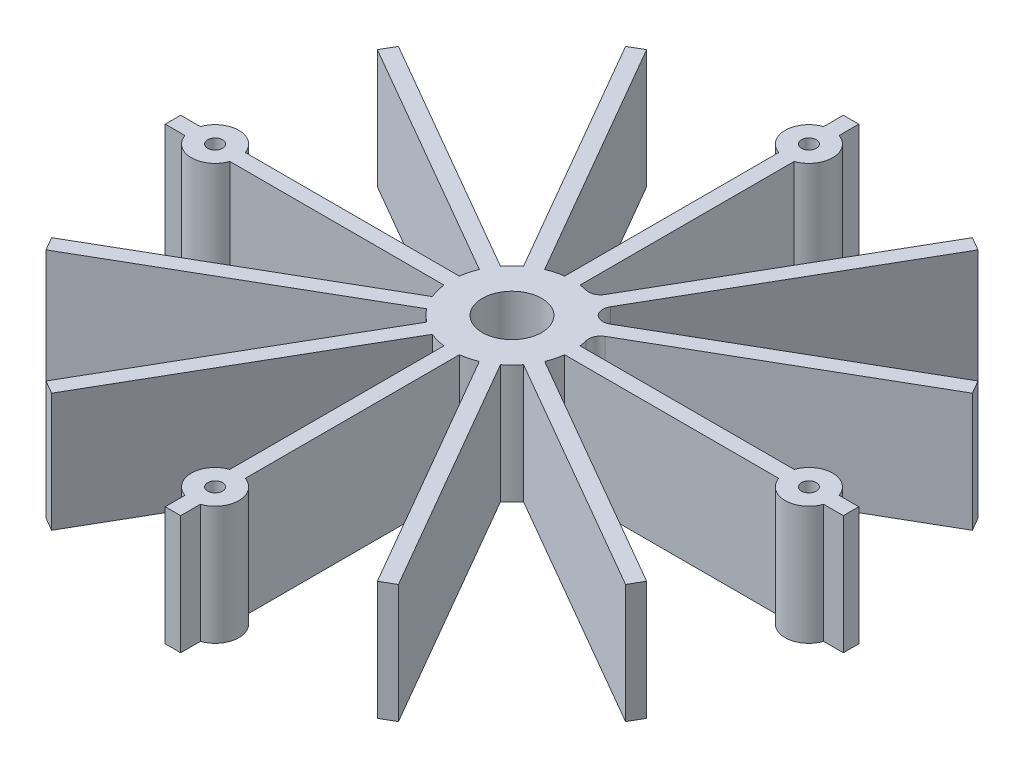
from build123d import *

# Parameters (mm, degrees)
SKETCH1_W           = 6.6675
SKETCH1_H           = 25.4
SKETCH2_W           = 3.302
SKETCH2_H           = 62.357
BOSS_EXTRUDE1_DEPTH = 25.4
CIRPATTERN1_COUNT   = 12
FILLET1_R           = 2.54
SKETCH4_R           = 5.08
SKETCH4_R_2         = 1.5875
BOSS_EXTRUDE2_DEPTH = 25.4
SKETCH5_R           = 1.5875
CUT_EXTRUDE2_DEPTH  = 25.4
CIRPATTERN2_COUNT   = 4


with BuildPart() as part:
    # Sketch1 → Revolve1 (revolve)
    with BuildSketch(Plane.XY, mode=Mode.PRIVATE) as revolve1_sk:
        with Locations((9.68375, 0)):
            Rectangle(SKETCH1_W, SKETCH1_H)
    revolve(revolve1_sk.sketch.rotate(Axis((0, 37.278132, 0), (0, -1, 0)), 90), axis=Axis((0, 37.278132, 0), (0, -1, 0)))

    # Sketch2 → Boss-Extrude1 (add)
    with BuildSketch(Plane(origin=(0, 12.7, 0), x_dir=(1, 0, 0), z_dir=(0, 1, 0))):
        with Locations((0, -41.3385)):
            Rectangle(SKETCH2_W, SKETCH2_H)
    boss_extrude1 = extrude(amount=-BOSS_EXTRUDE1_DEPTH)

    # CirPattern1: Boss-Extrude1 ×12 about axis
    cirpattern1_axis = Axis((0, 0, 0), (0, 1, 0))
    for i in range(1, CIRPATTERN1_COUNT):
        add(boss_extrude1.rotate(cirpattern1_axis, i * 360 / CIRPATTERN1_COUNT))

    # Fillet1
    # the kernel refuses this fillet: 2.54 mm, written as the material it adds along each edge
    with BuildSketch(Plane(origin=(12.007947359, 12.7, -5.026381051), x_dir=(0.8660254037844386, 0, -0.5000000000000003), z_dir=(0, -1, 0)), Plane(origin=(7.885996935, 12.7, -10.356947359), x_dir=(0.5000000000000001, 0, -0.8660254037844385), z_dir=(0, -1, 0))) as fillet1_piece_1:
        with BuildLine():
            CenterArc((2.069989159, 2.54), FILLET1_R, 195.62783797, 74.37216203)
            ThreePointArc((-0.3761116, 1.855755102), (-0.154269512, 0.934725122), (0, 0))
            Line((0, 0), (2.069989159, 0))
        make_face()
    extrude(amount=25.4)
    with BuildSketch(Plane(origin=(10.356947359, 12.7, -7.885996935), x_dir=(-0.6620593723913752, 0, -0.7494513909712479), z_dir=(0, -1, 0)), Plane(origin=(5.026381051, 12.7, -12.007947359), x_dir=(-0.9480859307901371, 0, -0.31801425728699545), z_dir=(0, -1, 0))) as fillet1_piece_2:
        with BuildLine():
            CenterArc((2.078215675, 2.533273519), FILLET1_R, 191.457121991, 74.37216203)
            Line((-0.411171344, 2.028741788), (0, 0))
            ThreePointArc((0, 0), (0.946742697, 0.034473214), (1.893485393, 0))
        make_face()
    extrude(amount=25.4)

    # Sketch4 → Boss-Extrude2 (add)
    with BuildSketch(Plane(origin=(0, 12.7, 0), x_dir=(1, 0, 0), z_dir=(0, 1, 0))):
        with Locations((0, 63.5)):
            Circle(SKETCH4_R)
        with Locations((0, 63.5)):
            Circle(SKETCH4_R_2, mode=Mode.SUBTRACT)
    boss_extrude2 = extrude(amount=-BOSS_EXTRUDE2_DEPTH)

    # Sketch5 → Cut-Extrude2 (cut)
    with BuildSketch(Plane(origin=(0, 12.7, 0), x_dir=(1, 0, 0), z_dir=(0, 1, 0))):
        with Locations(Location((0, 63.5, 0), (0, 0, 270))):
            Circle(SKETCH5_R)
    cut_extrude2 = extrude(amount=-CUT_EXTRUDE2_DEPTH, mode=Mode.SUBTRACT)

    # CirPattern2: Boss-Extrude2, Cut-Extrude2 ×4 about axis
    cirpattern2_axis = Axis((0, 0, 0), (0, 1, 0))
    add([boss_extrude2.rotate(cirpattern2_axis, i * 360 / CIRPATTERN2_COUNT) for i in range(1, CIRPATTERN2_COUNT)])
    add([cut_extrude2.rotate(cirpattern2_axis, i * 360 / CIRPATTERN2_COUNT) for i in range(1, CIRPATTERN2_COUNT)], mode=Mode.SUBTRACT)


solid = part.part
